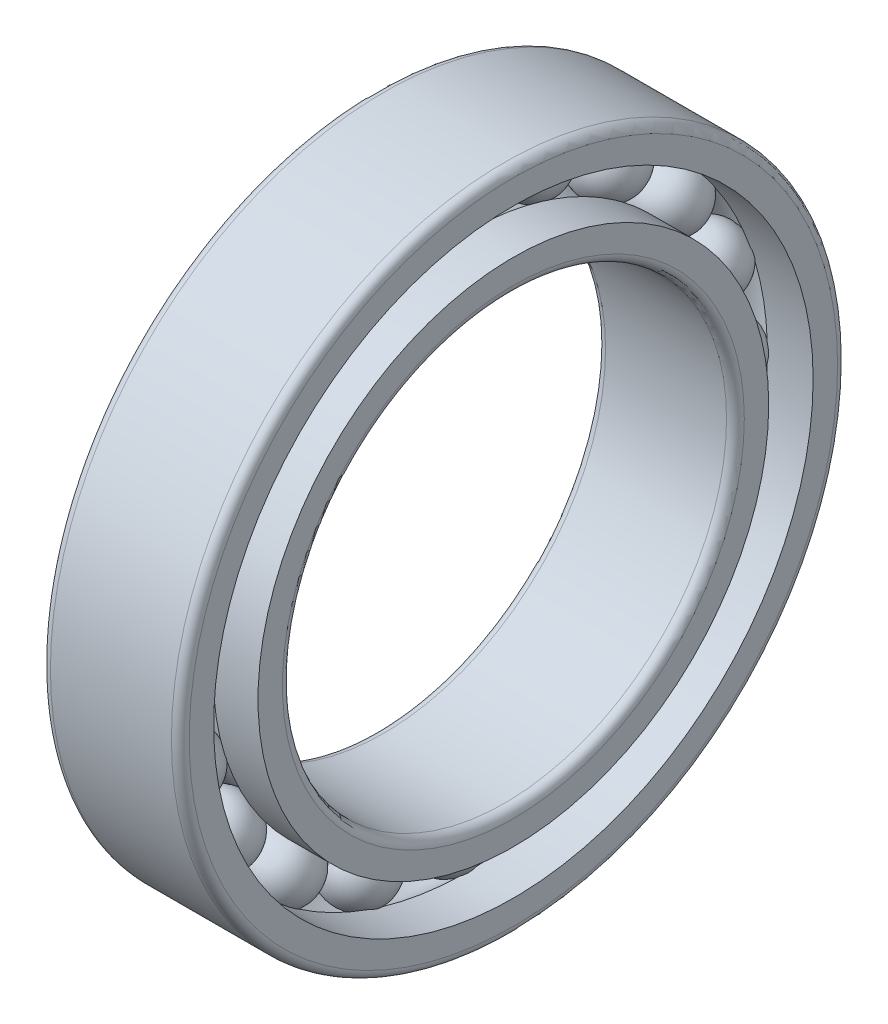
from build123d import *

# Parameters (mm, degrees)
CAGSPISKE_W         = 0.1905
CAGSPISKE_H         = 0.3175
CAGESPINE_ANGLE     = 0.001
BALLSDETAILED_COUNT = 20
BALLSDETAILED_ANGLE = 342


with BuildPart() as part:
    # CagSpiSke → CageSpine (revolve)
    with BuildSketch(Plane.XY):
        with Locations((0, 7.9375)):
            Rectangle(CAGSPISKE_W, CAGSPISKE_H)
    revolve(axis=Axis((-20.6375, 0, 0), (-1, 0, 0)), revolution_arc=CAGESPINE_ANGLE)

    # BalDetSke → BallDetailed (revolve)
    with BuildSketch(Plane.XY):
        with BuildLine():
            Line((-0.9525, 7.9375), (0.9525, 7.9375))
            ThreePointArc((0.9525, 7.9375), (0, 6.985), (-0.9525, 7.9375))
        make_face()
    balldetailed = revolve(axis=Axis((-1.905, 7.9375, 0), (1, 0, 0)))

    # InnRacSke → InnerRace (revolve)
    with BuildSketch(Plane.XY):
        with BuildLine():
            Line((-0.650091976, 7.3025), (-1.98374, 7.3025))
            Line((-1.98374, 7.3025), (-1.98374, 6.604))
            ThreePointArc((-1.98374, 6.604), (-1.909345122, 6.424394878), (-1.72974, 6.35))
            Line((-1.72974, 6.35), (1.72974, 6.35))
            ThreePointArc((1.72974, 6.35), (1.909345122, 6.424394878), (1.98374, 6.604))
            Line((1.98374, 6.604), (1.98374, 7.3025))
            Line((1.98374, 7.3025), (0.700891976, 7.3025))
            ThreePointArc((0.700891976, 7.3025), (0.0254, 7.0104), (-0.650091976, 7.3025))
        make_face()
    revolve(axis=Axis((-20.6375, 0, 0), (1, 0, 0)))

    # OutRacSke → OuterRace (revolve)
    with BuildSketch(Plane.XY):
        with BuildLine():
            Line((-0.675491976, 8.5725), (-1.98374, 8.5725))
            Line((-1.98374, 8.5725), (-1.98374, 9.271))
            ThreePointArc((-1.98374, 9.271), (-1.909345122, 9.450605122), (-1.72974, 9.525))
            Line((-1.72974, 9.525), (1.72974, 9.525))
            ThreePointArc((1.72974, 9.525), (1.909345122, 9.450605122), (1.98374, 9.271))
            Line((1.98374, 9.271), (1.98374, 8.5725))
            Line((1.98374, 8.5725), (0.675491976, 8.5725))
            ThreePointArc((0.675491976, 8.5725), (0, 8.8646), (-0.675491976, 8.5725))
        make_face()
    revolve(axis=Axis((-20.6375, 0, 0), (1, 0, 0)))

    # BallsDetailed: BallDetailed ×20 about axis
    ballsdetailed_axis = Axis((-50, 0, 0), (1, 0, 0))
    for i in range(1, BALLSDETAILED_COUNT):
        add(balldetailed.rotate(ballsdetailed_axis, i * BALLSDETAILED_ANGLE / (BALLSDETAILED_COUNT - 1)))


solid = part.part
